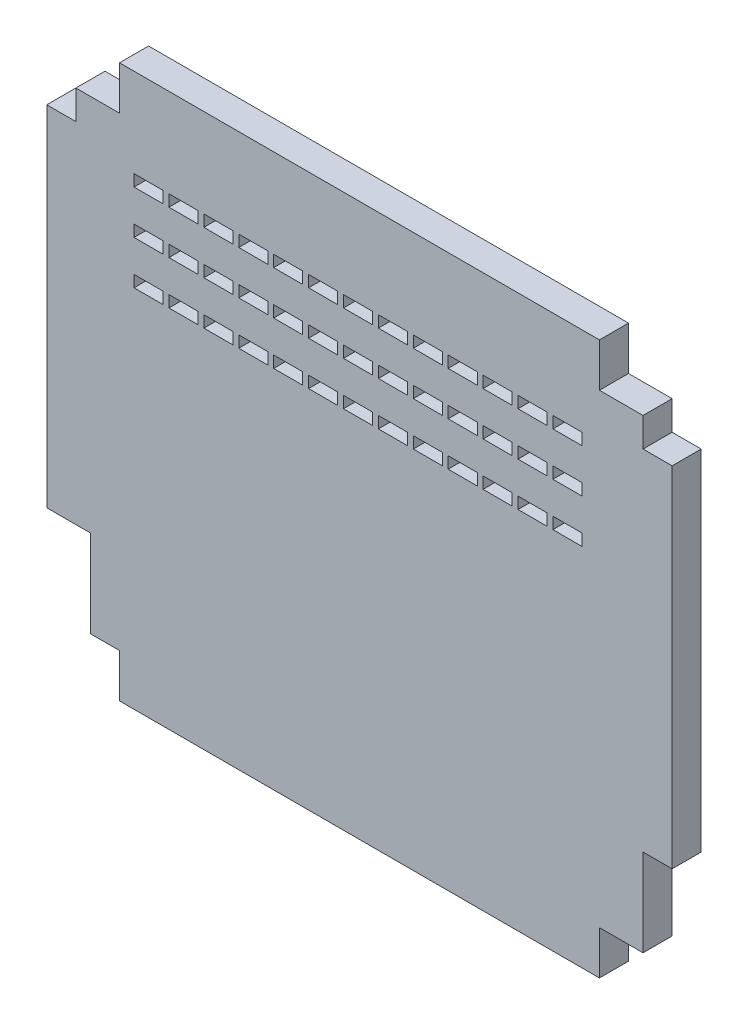
from build123d import *

# Parameters (mm, degrees)
EXTRUDE_1_DEPTH     = 10
SKETCH_2_W          = 10
SKETCH_2_H          = 10
CUT_EXTRUDE_2_DEPTH = 1
SKETCH_3_W          = 10
SKETCH_3_H          = 4
CUT_EXTRUDE_1_DEPTH = 219.532034265


with BuildPart() as part:
    # 草图1 → 凸台-拉伸1 (new body)
    with BuildSketch(Plane.XY):
        Polygon((-82.5, 0), (82.5, 0), (82.5, -15), (97.5, -15), (97.5, -25), (107.5, -25), (107.5, -145), (97.5, -145), (97.5, -175), (82.5, -175), (82.5, -190), (-82.5, -190), (-82.5, -175), (-92.5, -175), (-92.5, -145), (-107.5, -145), (-107.5, -25), (-97.5, -25), (-97.5, -15), (-82.5, -15), align=None)
    extrude(amount=EXTRUDE_1_DEPTH)

    # 草图2 → 切除-拉伸2 (cut)
    with BuildSketch(Plane(origin=(0, 0, 0), x_dir=(-1, 0, 0), z_dir=(0, 0, -1))):
        with Locations((-59.5, -10)):
            Rectangle(SKETCH_2_W, SKETCH_2_H)
        with Locations((72.5, -10)):
            Rectangle(SKETCH_2_W, SKETCH_2_H)
        with Locations((60.5, -10)):
            Rectangle(SKETCH_2_W, SKETCH_2_H)
        with Locations((48.5, -10)):
            Rectangle(SKETCH_2_W, SKETCH_2_H)
        with Locations((84.5, -25)):
            Rectangle(SKETCH_2_W, SKETCH_2_H)
        with Locations((84.5, -40)):
            Rectangle(SKETCH_2_W, SKETCH_2_H)
        with Locations((84.5, -55)):
            Rectangle(SKETCH_2_W, SKETCH_2_H)
        with Locations((84.5, -70)):
            Rectangle(SKETCH_2_W, SKETCH_2_H)
        with Locations((36.5, -10)):
            Rectangle(SKETCH_2_W, SKETCH_2_H)
        with Locations((24.5, -10)):
            Rectangle(SKETCH_2_W, SKETCH_2_H)
        with Locations((12.5, -10)):
            Rectangle(SKETCH_2_W, SKETCH_2_H)
        with Locations((0.5, -10)):
            Rectangle(SKETCH_2_W, SKETCH_2_H)
        with Locations((-11.5, -10)):
            Rectangle(SKETCH_2_W, SKETCH_2_H)
        with Locations((-23.5, -10)):
            Rectangle(SKETCH_2_W, SKETCH_2_H)
        with Locations((-35.5, -10)):
            Rectangle(SKETCH_2_W, SKETCH_2_H)
        with Locations((-47.5, -10)):
            Rectangle(SKETCH_2_W, SKETCH_2_H)
        with Locations((60.5, -25)):
            Rectangle(SKETCH_2_W, SKETCH_2_H)
        with Locations((48.5, -25)):
            Rectangle(SKETCH_2_W, SKETCH_2_H)
        with Locations((36.5, -25)):
            Rectangle(SKETCH_2_W, SKETCH_2_H)
        with Locations((24.5, -25)):
            Rectangle(SKETCH_2_W, SKETCH_2_H)
        with Locations((12.5, -25)):
            Rectangle(SKETCH_2_W, SKETCH_2_H)
        with Locations((0.5, -25)):
            Rectangle(SKETCH_2_W, SKETCH_2_H)
        with Locations((-11.5, -25)):
            Rectangle(SKETCH_2_W, SKETCH_2_H)
        with Locations((-23.5, -25)):
            Rectangle(SKETCH_2_W, SKETCH_2_H)
        with Locations((-35.5, -25)):
            Rectangle(SKETCH_2_W, SKETCH_2_H)
        with Locations((-47.5, -25)):
            Rectangle(SKETCH_2_W, SKETCH_2_H)
        with Locations((60.5, -40)):
            Rectangle(SKETCH_2_W, SKETCH_2_H)
        with Locations((48.5, -40)):
            Rectangle(SKETCH_2_W, SKETCH_2_H)
        with Locations((36.5, -40)):
            Rectangle(SKETCH_2_W, SKETCH_2_H)
        with Locations((24.5, -40)):
            Rectangle(SKETCH_2_W, SKETCH_2_H)
        with Locations((12.5, -40)):
            Rectangle(SKETCH_2_W, SKETCH_2_H)
        with Locations((0.5, -40)):
            Rectangle(SKETCH_2_W, SKETCH_2_H)
        with Locations((-11.5, -40)):
            Rectangle(SKETCH_2_W, SKETCH_2_H)
        with Locations((-23.5, -40)):
            Rectangle(SKETCH_2_W, SKETCH_2_H)
        with Locations((-35.5, -40)):
            Rectangle(SKETCH_2_W, SKETCH_2_H)
        with Locations((-47.5, -40)):
            Rectangle(SKETCH_2_W, SKETCH_2_H)
        with Locations((60.5, -55)):
            Rectangle(SKETCH_2_W, SKETCH_2_H)
        with Locations((48.5, -55)):
            Rectangle(SKETCH_2_W, SKETCH_2_H)
        with Locations((36.5, -55)):
            Rectangle(SKETCH_2_W, SKETCH_2_H)
        with Locations((24.5, -55)):
            Rectangle(SKETCH_2_W, SKETCH_2_H)
        with Locations((12.5, -55)):
            Rectangle(SKETCH_2_W, SKETCH_2_H)
        with Locations((0.5, -55)):
            Rectangle(SKETCH_2_W, SKETCH_2_H)
        with Locations((-11.5, -55)):
            Rectangle(SKETCH_2_W, SKETCH_2_H)
        with Locations((-23.5, -55)):
            Rectangle(SKETCH_2_W, SKETCH_2_H)
        with Locations((-35.5, -55)):
            Rectangle(SKETCH_2_W, SKETCH_2_H)
        with Locations((-47.5, -55)):
            Rectangle(SKETCH_2_W, SKETCH_2_H)
        with Locations((60.5, -70)):
            Rectangle(SKETCH_2_W, SKETCH_2_H)
        with Locations((48.5, -70)):
            Rectangle(SKETCH_2_W, SKETCH_2_H)
        with Locations((36.5, -70)):
            Rectangle(SKETCH_2_W, SKETCH_2_H)
        with Locations((24.5, -70)):
            Rectangle(SKETCH_2_W, SKETCH_2_H)
        with Locations((12.5, -70)):
            Rectangle(SKETCH_2_W, SKETCH_2_H)
        with Locations((0.5, -70)):
            Rectangle(SKETCH_2_W, SKETCH_2_H)
        with Locations((-11.5, -70)):
            Rectangle(SKETCH_2_W, SKETCH_2_H)
        with Locations((-23.5, -70)):
            Rectangle(SKETCH_2_W, SKETCH_2_H)
        with Locations((-35.5, -70)):
            Rectangle(SKETCH_2_W, SKETCH_2_H)
        with Locations((-47.5, -70)):
            Rectangle(SKETCH_2_W, SKETCH_2_H)
        with Locations((60.5, -85)):
            Rectangle(SKETCH_2_W, SKETCH_2_H)
        with Locations((48.5, -85)):
            Rectangle(SKETCH_2_W, SKETCH_2_H)
        with Locations((36.5, -85)):
            Rectangle(SKETCH_2_W, SKETCH_2_H)
        with Locations((24.5, -85)):
            Rectangle(SKETCH_2_W, SKETCH_2_H)
        with Locations((12.5, -85)):
            Rectangle(SKETCH_2_W, SKETCH_2_H)
        with Locations((0.5, -85)):
            Rectangle(SKETCH_2_W, SKETCH_2_H)
        with Locations((-11.5, -85)):
            Rectangle(SKETCH_2_W, SKETCH_2_H)
        with Locations((-23.5, -85)):
            Rectangle(SKETCH_2_W, SKETCH_2_H)
        with Locations((-35.5, -85)):
            Rectangle(SKETCH_2_W, SKETCH_2_H)
        with Locations((-47.5, -85)):
            Rectangle(SKETCH_2_W, SKETCH_2_H)
        with Locations((60.5, -100)):
            Rectangle(SKETCH_2_W, SKETCH_2_H)
        with Locations((48.5, -100)):
            Rectangle(SKETCH_2_W, SKETCH_2_H)
        with Locations((36.5, -100)):
            Rectangle(SKETCH_2_W, SKETCH_2_H)
        with Locations((24.5, -100)):
            Rectangle(SKETCH_2_W, SKETCH_2_H)
        with Locations((12.5, -100)):
            Rectangle(SKETCH_2_W, SKETCH_2_H)
        with Locations((0.5, -100)):
            Rectangle(SKETCH_2_W, SKETCH_2_H)
        with Locations((-11.5, -100)):
            Rectangle(SKETCH_2_W, SKETCH_2_H)
        with Locations((-23.5, -100)):
            Rectangle(SKETCH_2_W, SKETCH_2_H)
        with Locations((-35.5, -100)):
            Rectangle(SKETCH_2_W, SKETCH_2_H)
        with Locations((-47.5, -100)):
            Rectangle(SKETCH_2_W, SKETCH_2_H)
        with Locations((60.5, -115)):
            Rectangle(SKETCH_2_W, SKETCH_2_H)
        with Locations((48.5, -115)):
            Rectangle(SKETCH_2_W, SKETCH_2_H)
        with Locations((36.5, -115)):
            Rectangle(SKETCH_2_W, SKETCH_2_H)
        with Locations((24.5, -115)):
            Rectangle(SKETCH_2_W, SKETCH_2_H)
        with Locations((12.5, -115)):
            Rectangle(SKETCH_2_W, SKETCH_2_H)
        with Locations((0.5, -115)):
            Rectangle(SKETCH_2_W, SKETCH_2_H)
        with Locations((-11.5, -115)):
            Rectangle(SKETCH_2_W, SKETCH_2_H)
        with Locations((-23.5, -115)):
            Rectangle(SKETCH_2_W, SKETCH_2_H)
        with Locations((-35.5, -115)):
            Rectangle(SKETCH_2_W, SKETCH_2_H)
        with Locations((-47.5, -115)):
            Rectangle(SKETCH_2_W, SKETCH_2_H)
        with Locations((60.5, -130)):
            Rectangle(SKETCH_2_W, SKETCH_2_H)
        with Locations((48.5, -130)):
            Rectangle(SKETCH_2_W, SKETCH_2_H)
        with Locations((36.5, -130)):
            Rectangle(SKETCH_2_W, SKETCH_2_H)
        with Locations((24.5, -130)):
            Rectangle(SKETCH_2_W, SKETCH_2_H)
        with Locations((12.5, -130)):
            Rectangle(SKETCH_2_W, SKETCH_2_H)
        with Locations((0.5, -130)):
            Rectangle(SKETCH_2_W, SKETCH_2_H)
        with Locations((-11.5, -130)):
            Rectangle(SKETCH_2_W, SKETCH_2_H)
        with Locations((-23.5, -130)):
            Rectangle(SKETCH_2_W, SKETCH_2_H)
        with Locations((-35.5, -130)):
            Rectangle(SKETCH_2_W, SKETCH_2_H)
        with Locations((-47.5, -130)):
            Rectangle(SKETCH_2_W, SKETCH_2_H)
        with Locations((60.5, -145)):
            Rectangle(SKETCH_2_W, SKETCH_2_H)
        with Locations((48.5, -145)):
            Rectangle(SKETCH_2_W, SKETCH_2_H)
        with Locations((36.5, -145)):
            Rectangle(SKETCH_2_W, SKETCH_2_H)
        with Locations((24.5, -145)):
            Rectangle(SKETCH_2_W, SKETCH_2_H)
        with Locations((12.5, -145)):
            Rectangle(SKETCH_2_W, SKETCH_2_H)
        with Locations((0.5, -145)):
            Rectangle(SKETCH_2_W, SKETCH_2_H)
        with Locations((-11.5, -145)):
            Rectangle(SKETCH_2_W, SKETCH_2_H)
        with Locations((-23.5, -145)):
            Rectangle(SKETCH_2_W, SKETCH_2_H)
        with Locations((-35.5, -145)):
            Rectangle(SKETCH_2_W, SKETCH_2_H)
        with Locations((-47.5, -145)):
            Rectangle(SKETCH_2_W, SKETCH_2_H)
        with Locations((60.5, -160)):
            Rectangle(SKETCH_2_W, SKETCH_2_H)
        with Locations((48.5, -160)):
            Rectangle(SKETCH_2_W, SKETCH_2_H)
        with Locations((36.5, -160)):
            Rectangle(SKETCH_2_W, SKETCH_2_H)
        with Locations((24.5, -160)):
            Rectangle(SKETCH_2_W, SKETCH_2_H)
        with Locations((12.5, -160)):
            Rectangle(SKETCH_2_W, SKETCH_2_H)
        with Locations((0.5, -160)):
            Rectangle(SKETCH_2_W, SKETCH_2_H)
        with Locations((-11.5, -160)):
            Rectangle(SKETCH_2_W, SKETCH_2_H)
        with Locations((-23.5, -160)):
            Rectangle(SKETCH_2_W, SKETCH_2_H)
        with Locations((-35.5, -160)):
            Rectangle(SKETCH_2_W, SKETCH_2_H)
        with Locations((-47.5, -160)):
            Rectangle(SKETCH_2_W, SKETCH_2_H)
        with Locations((60.5, -175)):
            Rectangle(SKETCH_2_W, SKETCH_2_H)
        with Locations((48.5, -175)):
            Rectangle(SKETCH_2_W, SKETCH_2_H)
        with Locations((36.5, -175)):
            Rectangle(SKETCH_2_W, SKETCH_2_H)
        with Locations((24.5, -175)):
            Rectangle(SKETCH_2_W, SKETCH_2_H)
        with Locations((12.5, -175)):
            Rectangle(SKETCH_2_W, SKETCH_2_H)
        with Locations((0.5, -175)):
            Rectangle(SKETCH_2_W, SKETCH_2_H)
        with Locations((-11.5, -175)):
            Rectangle(SKETCH_2_W, SKETCH_2_H)
        with Locations((-23.5, -175)):
            Rectangle(SKETCH_2_W, SKETCH_2_H)
        with Locations((-35.5, -175)):
            Rectangle(SKETCH_2_W, SKETCH_2_H)
        with Locations((-47.5, -175)):
            Rectangle(SKETCH_2_W, SKETCH_2_H)
        with Locations((72.5, -25)):
            Rectangle(SKETCH_2_W, SKETCH_2_H)
        with Locations((72.5, -40)):
            Rectangle(SKETCH_2_W, SKETCH_2_H)
        with Locations((72.5, -55)):
            Rectangle(SKETCH_2_W, SKETCH_2_H)
        with Locations((72.5, -70)):
            Rectangle(SKETCH_2_W, SKETCH_2_H)
        with Locations((72.5, -85)):
            Rectangle(SKETCH_2_W, SKETCH_2_H)
        with Locations((72.5, -100)):
            Rectangle(SKETCH_2_W, SKETCH_2_H)
        with Locations((72.5, -115)):
            Rectangle(SKETCH_2_W, SKETCH_2_H)
        with Locations((72.5, -130)):
            Rectangle(SKETCH_2_W, SKETCH_2_H)
        with Locations((72.5, -145)):
            Rectangle(SKETCH_2_W, SKETCH_2_H)
        with Locations((72.5, -160)):
            Rectangle(SKETCH_2_W, SKETCH_2_H)
        with Locations((72.5, -175)):
            Rectangle(SKETCH_2_W, SKETCH_2_H)
        with Locations((84.5, -85)):
            Rectangle(SKETCH_2_W, SKETCH_2_H)
        with Locations((84.5, -100)):
            Rectangle(SKETCH_2_W, SKETCH_2_H)
        with Locations((84.5, -115)):
            Rectangle(SKETCH_2_W, SKETCH_2_H)
        with Locations((84.5, -130)):
            Rectangle(SKETCH_2_W, SKETCH_2_H)
        with Locations((-59.5, -25)):
            Rectangle(SKETCH_2_W, SKETCH_2_H)
        with Locations((-59.5, -40)):
            Rectangle(SKETCH_2_W, SKETCH_2_H)
        with Locations((-59.5, -55)):
            Rectangle(SKETCH_2_W, SKETCH_2_H)
        with Locations((-59.5, -70)):
            Rectangle(SKETCH_2_W, SKETCH_2_H)
        with Locations((-59.5, -85)):
            Rectangle(SKETCH_2_W, SKETCH_2_H)
        with Locations((-59.5, -100)):
            Rectangle(SKETCH_2_W, SKETCH_2_H)
        with Locations((-59.5, -115)):
            Rectangle(SKETCH_2_W, SKETCH_2_H)
        with Locations((-59.5, -130)):
            Rectangle(SKETCH_2_W, SKETCH_2_H)
        with Locations((-71.5, -10)):
            Rectangle(SKETCH_2_W, SKETCH_2_H)
        with Locations((-71.5, -25)):
            Rectangle(SKETCH_2_W, SKETCH_2_H)
        with Locations((-71.5, -40)):
            Rectangle(SKETCH_2_W, SKETCH_2_H)
        with Locations((-71.5, -55)):
            Rectangle(SKETCH_2_W, SKETCH_2_H)
        with Locations((-71.5, -70)):
            Rectangle(SKETCH_2_W, SKETCH_2_H)
        with Locations((-71.5, -85)):
            Rectangle(SKETCH_2_W, SKETCH_2_H)
        with Locations((-71.5, -100)):
            Rectangle(SKETCH_2_W, SKETCH_2_H)
        with Locations((-71.5, -115)):
            Rectangle(SKETCH_2_W, SKETCH_2_H)
        with Locations((-71.5, -130)):
            Rectangle(SKETCH_2_W, SKETCH_2_H)
        with Locations((-83.5, -25)):
            Rectangle(SKETCH_2_W, SKETCH_2_H)
        with Locations((-83.5, -40)):
            Rectangle(SKETCH_2_W, SKETCH_2_H)
        with Locations((-83.5, -55)):
            Rectangle(SKETCH_2_W, SKETCH_2_H)
        with Locations((-83.5, -70)):
            Rectangle(SKETCH_2_W, SKETCH_2_H)
        with Locations((-83.5, -85)):
            Rectangle(SKETCH_2_W, SKETCH_2_H)
        with Locations((-83.5, -100)):
            Rectangle(SKETCH_2_W, SKETCH_2_H)
        with Locations((-83.5, -115)):
            Rectangle(SKETCH_2_W, SKETCH_2_H)
        with Locations((-83.5, -130)):
            Rectangle(SKETCH_2_W, SKETCH_2_H)
        with Locations((-59.5, -145)):
            Rectangle(SKETCH_2_W, SKETCH_2_H)
        with Locations((-59.5, -160)):
            Rectangle(SKETCH_2_W, SKETCH_2_H)
        with Locations((-59.5, -175)):
            Rectangle(SKETCH_2_W, SKETCH_2_H)
        with Locations((-71.5, -145)):
            Rectangle(SKETCH_2_W, SKETCH_2_H)
        with Locations((-71.5, -160)):
            Rectangle(SKETCH_2_W, SKETCH_2_H)
        with Locations((-71.5, -175)):
            Rectangle(SKETCH_2_W, SKETCH_2_H)
    extrude(amount=-CUT_EXTRUDE_2_DEPTH, mode=Mode.SUBTRACT)

    # 草图3 → 切除-拉伸1 (cut, through all)
    with BuildSketch(Plane(origin=(0, 0, 0), x_dir=(-1, 0, 0), z_dir=(0, 0, -1))):
        with Locations((-47.5, -32.5)):
            Rectangle(SKETCH_3_W, SKETCH_3_H)
        with Locations((-59.5, -32.5)):
            Rectangle(SKETCH_3_W, SKETCH_3_H)
        with Locations((-35.5, -32.5)):
            Rectangle(SKETCH_3_W, SKETCH_3_H)
        with Locations((-23.5, -32.5)):
            Rectangle(SKETCH_3_W, SKETCH_3_H)
        with Locations((-11.5, -32.5)):
            Rectangle(SKETCH_3_W, SKETCH_3_H)
        with Locations((0.5, -32.5)):
            Rectangle(SKETCH_3_W, SKETCH_3_H)
        with Locations((12.5, -32.5)):
            Rectangle(SKETCH_3_W, SKETCH_3_H)
        with Locations((24.5, -32.5)):
            Rectangle(SKETCH_3_W, SKETCH_3_H)
        with Locations((36.5, -32.5)):
            Rectangle(SKETCH_3_W, SKETCH_3_H)
        with Locations((48.5, -32.5)):
            Rectangle(SKETCH_3_W, SKETCH_3_H)
        with Locations((60.5, -32.5)):
            Rectangle(SKETCH_3_W, SKETCH_3_H)
        with Locations((72.5, -32.5)):
            Rectangle(SKETCH_3_W, SKETCH_3_H)
        with Locations((-35.5, -47.5)):
            Rectangle(SKETCH_3_W, SKETCH_3_H)
        with Locations((-23.5, -47.5)):
            Rectangle(SKETCH_3_W, SKETCH_3_H)
        with Locations((-11.5, -47.5)):
            Rectangle(SKETCH_3_W, SKETCH_3_H)
        with Locations((0.5, -47.5)):
            Rectangle(SKETCH_3_W, SKETCH_3_H)
        with Locations((12.5, -47.5)):
            Rectangle(SKETCH_3_W, SKETCH_3_H)
        with Locations((24.5, -47.5)):
            Rectangle(SKETCH_3_W, SKETCH_3_H)
        with Locations((36.5, -47.5)):
            Rectangle(SKETCH_3_W, SKETCH_3_H)
        with Locations((48.5, -47.5)):
            Rectangle(SKETCH_3_W, SKETCH_3_H)
        with Locations((60.5, -47.5)):
            Rectangle(SKETCH_3_W, SKETCH_3_H)
        with Locations((72.5, -47.5)):
            Rectangle(SKETCH_3_W, SKETCH_3_H)
        with Locations((-35.5, -62.5)):
            Rectangle(SKETCH_3_W, SKETCH_3_H)
        with Locations((-23.5, -62.5)):
            Rectangle(SKETCH_3_W, SKETCH_3_H)
        with Locations((-11.5, -62.5)):
            Rectangle(SKETCH_3_W, SKETCH_3_H)
        with Locations((0.5, -62.5)):
            Rectangle(SKETCH_3_W, SKETCH_3_H)
        with Locations((12.5, -62.5)):
            Rectangle(SKETCH_3_W, SKETCH_3_H)
        with Locations((24.5, -62.5)):
            Rectangle(SKETCH_3_W, SKETCH_3_H)
        with Locations((36.5, -62.5)):
            Rectangle(SKETCH_3_W, SKETCH_3_H)
        with Locations((48.5, -62.5)):
            Rectangle(SKETCH_3_W, SKETCH_3_H)
        with Locations((60.5, -62.5)):
            Rectangle(SKETCH_3_W, SKETCH_3_H)
        with Locations((72.5, -62.5)):
            Rectangle(SKETCH_3_W, SKETCH_3_H)
        with Locations((-47.5, -47.5)):
            Rectangle(SKETCH_3_W, SKETCH_3_H)
        with Locations((-47.5, -62.5)):
            Rectangle(SKETCH_3_W, SKETCH_3_H)
        with Locations((-59.5, -47.5)):
            Rectangle(SKETCH_3_W, SKETCH_3_H)
        with Locations((-59.5, -62.5)):
            Rectangle(SKETCH_3_W, SKETCH_3_H)
        with Locations((-71.5, -32.5)):
            Rectangle(SKETCH_3_W, SKETCH_3_H)
        with Locations((-71.5, -47.5)):
            Rectangle(SKETCH_3_W, SKETCH_3_H)
        with Locations((-71.5, -62.5)):
            Rectangle(SKETCH_3_W, SKETCH_3_H)
    extrude(amount=-CUT_EXTRUDE_1_DEPTH, mode=Mode.SUBTRACT)


solid = part.part
